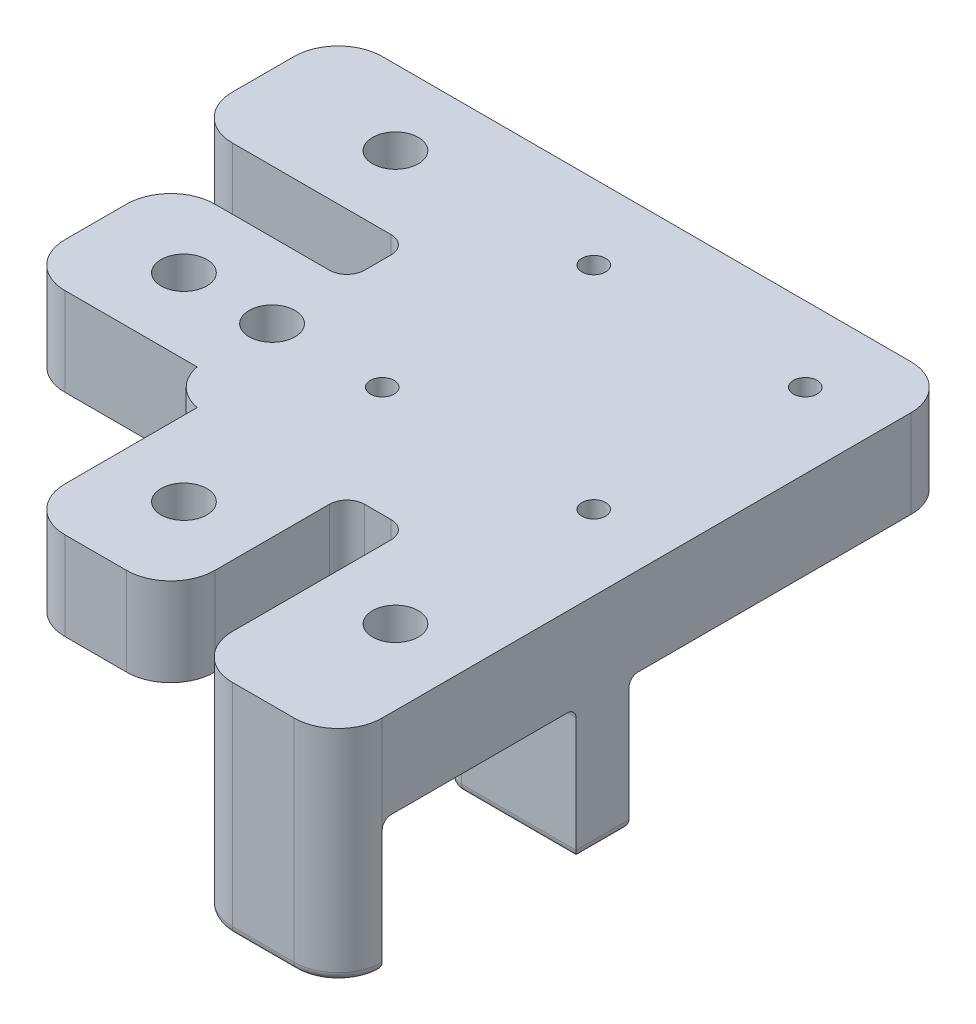
from build123d import *

# Parameters (mm, degrees)
SKETCH1_W                = 65
SKETCH1_H                = 65
BOSS_EXTRUDE2_DEPTH      = 10
SKETCH6_R                = 1.35
CUT_EXTRUDE3_DEPTH       = 93.466210045
SKETCH7_R                = 2.6
SKETCH7_W                = 20
SKETCH7_H                = 7
SKETCH7_W_2              = 7
SKETCH7_H_2              = 20
CUT_EXTRUDE4_DEPTH       = 93.466210045
SKETCH9_W                = 15
SKETCH9_H                = 6
SKETCH9_W_2              = 6
SKETCH9_H_2              = 15
BOSS_EXTRUDE5_DEPTH      = 15
FILLET4_R                = 2
FILLET5_R                = 1
FILLET6_R                = 1
BOSS_EXTRUDE6_DEPTH      = 15
BOSS_EXTRUDE6_DEPTH_BACK = 10
SKETCH10_W               = 17
SKETCH10_H               = 5
SKETCH10_W_2             = 5
SKETCH10_H_2             = 17
FILLET7_R                = 5
FILLET8_R                = 1
SKETCH11_R               = 2.6
CUT_EXTRUDE5_DEPTH       = 96.262794579


with BuildPart() as part:
    # Sketch1 → Boss-Extrude2 (new body)
    with BuildSketch(Plane(origin=(0, 0, 0), x_dir=(1, 0, 0), z_dir=(0, 1, 0))):
        with Locations((32.5, 32.5)):
            Rectangle(SKETCH1_W, SKETCH1_H)
    extrude(amount=BOSS_EXTRUDE2_DEPTH)

    # Sketch6 → Cut-Extrude3 (cut, through all)
    with BuildSketch(Plane(origin=(0, 10, 0), x_dir=(1, 0, 0), z_dir=(0, 1, 0))):
        with Locations(Location((56.5, 56.5, 0), (0, 0, 270))):
            Circle(SKETCH6_R)
        with Locations(Location((32.5, 56.5, 0), (0, 0, 270))):
            Circle(SKETCH6_R)
        with Locations(Location((32.5, 32.5, 0), (0, 0, 270))):
            Circle(SKETCH6_R)
        with Locations(Location((56.5, 32.5, 0), (0, 0, 270))):
            Circle(SKETCH6_R)
    extrude(amount=-CUT_EXTRUDE3_DEPTH, mode=Mode.SUBTRACT)

    # Sketch7 → Cut-Extrude4 (cut, through all)
    with BuildSketch(Plane(origin=(0, 10, 0), x_dir=(1, 0, 0), z_dir=(0, 1, 0))):
        with Locations(Location((10, 32.5, 0), (0, 0, 270))):
            Circle(SKETCH7_R)
        with Locations(Location((10, 56.5, 0), (0, 0, 270))):
            Circle(SKETCH7_R)
        with Locations(Location((32.5, 10, 0), (0, 0, 270))):
            Circle(SKETCH7_R)
        with Locations(Location((56.5, 10, 0), (0, 0, 270))):
            Circle(SKETCH7_R)
        with Locations((10, 44.5)):
            Rectangle(SKETCH7_W, SKETCH7_H)
        with Locations((44.5, 10)):
            Rectangle(SKETCH7_W_2, SKETCH7_H_2)
        Polygon((0, 24), (20, 24), (20, 20), (24, 20), (24, 0), (20, 0), (0, 0), (0, 20), align=None)
    extrude(amount=-CUT_EXTRUDE4_DEPTH, mode=Mode.SUBTRACT)

    # Sketch9 → Boss-Extrude5 (add)
    with BuildSketch(Plane.XZ):
        with Locations((57.5, -25)):
            Rectangle(SKETCH9_W, SKETCH9_H)
        with Locations((25, -57.5)):
            Rectangle(SKETCH9_W_2, SKETCH9_H_2)
    extrude(amount=BOSS_EXTRUDE5_DEPTH)

    # Fillet4
    fillet4_edges = [part.edges().sort_by_distance(p)[0] for p in [
        (50, -7.5, -22),
        (50, -7.5, -28),
        (22, -7.5, -50),
        (28, -7.5, -50),
        (41, 5, -20),
        (48, 5, -20),
        (20, 5, -48),
        (20, 5, -41),
    ]]
    fillet(fillet4_edges, radius=FILLET4_R)

    # Fillet5
    fillet5_edges = [part.edges().sort_by_distance(p)[0] for p in [
        (58.5, 0, -22),
        (28, 0, -58.5),
        (22, 0, -58.5),
        (25, 0, -50),
        (58.5, 0, -28),
        (50, 0, -25),
        (22.585786438, 0, -50.585786438),
        (27.414213562, 0, -50.585786438),
        (50.585786438, 0, -27.414213562),
        (50.585786438, 0, -22.585786438),
    ]]
    fillet(fillet5_edges, radius=FILLET5_R)

    # Fillet6
    fillet6_edges = [part.edges().sort_by_distance(p)[0] for p in [
        (65, -15, -25),
        (58.5, -15, -22),
        (25, -15, -65),
        (28, -15, -58.5),
        (22, -15, -58.5),
        (25, -15, -50),
        (27.414213562, -15, -50.585786438),
        (22.585786438, -15, -50.585786438),
        (58.5, -15, -28),
        (50, -15, -25),
        (50.585786438, -15, -22.585786438),
        (50.585786438, -15, -27.414213562),
    ]]
    fillet(fillet6_edges, radius=FILLET6_R)

    # Sketch10 → Boss-Extrude6 (add, two sides: drawn at the far end of the back side and taken through both)
    with BuildSketch(Plane.XZ.offset(-BOSS_EXTRUDE6_DEPTH_BACK)):
        with Locations((56.5, 2.5)):
            Rectangle(SKETCH10_W, SKETCH10_H)
        with Locations((-2.5, -56.5)):
            Rectangle(SKETCH10_W_2, SKETCH10_H_2)
    extrude(amount=BOSS_EXTRUDE6_DEPTH + BOSS_EXTRUDE6_DEPTH_BACK)

    # Fillet7
    # the kernel refuses this fillet: 5 mm, written as the material it takes off along each edge
    with BuildSketch(Plane(origin=(65, -12.5, -65), x_dir=(-1, 0, 0), z_dir=(0, 1, 0)), Plane(origin=(41, 22.5, 0), x_dir=(-1, 0, 0), z_dir=(0, -1, 0)), Plane(origin=(24, 22.5, 0), x_dir=(0, 0, -1), z_dir=(0, -1, 0)), Plane(origin=(0, 22.5, -24), x_dir=(0, 0, -1), z_dir=(0, -1, 0)), Plane(origin=(0, 22.5, -41), x_dir=(1, 0, 0), z_dir=(0, -1, 0))) as fillet7_piece_1:
        with BuildLine():
            CenterArc((FILLET7_R, FILLET7_R), FILLET7_R, 180, 90)
            Line((0, FILLET7_R), (0, 0))
            Line((0, 0), (FILLET7_R, 0))
        make_face()
    extrude(amount=35, mode=Mode.SUBTRACT)
    with BuildSketch(Plane(origin=(65, 22.5, 5), x_dir=(-1, 0, 0), z_dir=(0, -1, 0)), Plane(origin=(-5, 22.5, -65), x_dir=(1, 0, 0), z_dir=(0, -1, 0))) as fillet7_piece_2:
        with BuildLine():
            CenterArc((FILLET7_R, FILLET7_R), FILLET7_R, 180, 90)
            Line((0, FILLET7_R), (0, 0))
            Line((0, 0), (FILLET7_R, 0))
        make_face()
    extrude(amount=50, mode=Mode.SUBTRACT)
    with BuildSketch(Plane(origin=(48, -27.5, 5), x_dir=(0, 0, -1), z_dir=(0, 1, 0)), Plane(origin=(-5, 22.5, -48), x_dir=(1, 0, 0), z_dir=(0, -1, 0))) as fillet7_piece_3:
        with BuildLine():
            CenterArc((FILLET7_R, -FILLET7_R), FILLET7_R, 90, 90)
            Line((0, -FILLET7_R), (0, 0))
            Line((0, 0), (FILLET7_R, 0))
        make_face()
    extrude(amount=50, mode=Mode.SUBTRACT)
    with BuildSketch(Plane(origin=(20, 20, -20), x_dir=(0, 0, -1), z_dir=(0, -1, 0))) as fillet7_piece_4:
        with BuildLine():
            CenterArc((4.915475947, 4.915475947), FILLET7_R, 190.550098012, 68.899803976)
            Line((0, 4), (0, 0))
            Line((0, 0), (4, 0))
        make_face()
    extrude(amount=30, mode=Mode.SUBTRACT)

    # Fillet8
    fillet8_edges = [part.edges().sort_by_distance(p)[0] for p in [
        (56.5, -15, 0),
        (0, -15, -56.5),
        (56.5, -15, 5),
        (49.464466094, -15, 3.535533906),
        (63.535533906, -15, 3.535533906),
        (-5, -15, -56.5),
        (-3.535533906, -15, -63.535533906),
        (-3.535533906, -15, -49.464466094),
        (56.5, 0, 0),
        (0, 0, -56.5),
    ]]
    fillet(fillet8_edges, radius=FILLET8_R)

    # Sketch11 → Cut-Extrude5 (cut, through all)
    with BuildSketch(Plane(origin=(0, 10, 0), x_dir=(1, 0, 0), z_dir=(0, 1, 0))):
        with Locations(Location((20, 32.5, 0), (0, 0, 270))):
            Circle(SKETCH11_R)
    extrude(amount=-CUT_EXTRUDE5_DEPTH, mode=Mode.SUBTRACT)


solid = part.part
